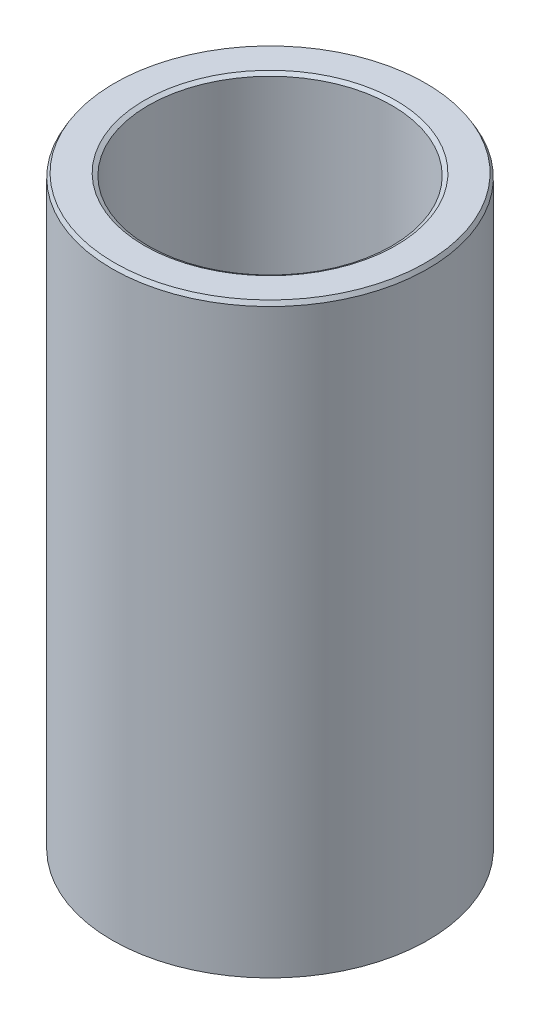
from build123d import *
from OCP.BRepFilletAPI import BRepFilletAPI_MakeChamfer

# Parameters (mm, degrees)
SKETCH1_R           = 57.5
BOSS_EXTRUDE1_DEPTH = 214.036817135
SKETCH2_R           = 44.333103973
CUT_EXTRUDE1_DEPTH  = 229.963444876
CHAMFER1_SIZE       = 1.472510434
CHAMFER1_SIZE2      = 0.850154295


with BuildPart() as part:
    # Sketch1 → Boss-Extrude1 (new body)
    with BuildSketch(Plane(origin=(0, 0, 0), x_dir=(1, 0, 0), z_dir=(0, 1, 0))):
        Circle(SKETCH1_R)
    extrude(amount=BOSS_EXTRUDE1_DEPTH)

    # Sketch2 → Cut-Extrude1 (cut, through all)
    with BuildSketch(Plane(origin=(0, 0, 0), x_dir=(1, 0, 0), z_dir=(0, 1, 0))):
        Circle(SKETCH2_R)
    extrude(amount=CUT_EXTRUDE1_DEPTH, mode=Mode.SUBTRACT)

    # Chamfer1: one chamfer whose edges measure the first distance from different faces: ONE call of the kernel's chamfer builder (chamfer() names one face for all edges)
    chamfer1_edges_1 = [part.edges().sort_by_distance(p)[0] for p in [
        (-44.333103973, 214.036817135, 0),
    ]]
    chamfer1_side_1 = [part.faces().sort_by_distance(p)[0] for p in [
        (-55.873654403, 214.036817135, 0),
    ]]
    chamfer1_edges_2 = [part.edges().sort_by_distance(p)[0] for p in [
        (-44.333103973, 0, 0),
    ]]
    chamfer1_side_2 = [part.faces().sort_by_distance(p)[0] for p in [
        (-44.333103973, 107.018408568, 0),
    ]]
    chamfer1_edges_3 = [part.edges().sort_by_distance(p)[0] for p in [
        (-57.5, 0, 0),
    ]]
    chamfer1_side_3 = [part.faces().sort_by_distance(p)[0] for p in [
        (-55.873654403, 0, 0),
    ]]
    chamfer1_edges_4 = [part.edges().sort_by_distance(p)[0] for p in [
        (-57.5, 214.036817135, 0),
    ]]
    chamfer1_side_4 = [part.faces().sort_by_distance(p)[0] for p in [
        (-57.5, 107.018408568, 0),
    ]]
    chamfer1 = BRepFilletAPI_MakeChamfer(part.part.solid().wrapped)
    for e in chamfer1_edges_1:
        chamfer1.Add(CHAMFER1_SIZE, CHAMFER1_SIZE2, e.wrapped, chamfer1_side_1[0].wrapped)  # the first distance lies on this face
    for e in chamfer1_edges_2:
        chamfer1.Add(CHAMFER1_SIZE, CHAMFER1_SIZE2, e.wrapped, chamfer1_side_2[0].wrapped)  # the first distance lies on this face
    for e in chamfer1_edges_3:
        chamfer1.Add(CHAMFER1_SIZE, CHAMFER1_SIZE2, e.wrapped, chamfer1_side_3[0].wrapped)  # the first distance lies on this face
    for e in chamfer1_edges_4:
        chamfer1.Add(CHAMFER1_SIZE, CHAMFER1_SIZE2, e.wrapped, chamfer1_side_4[0].wrapped)  # the first distance lies on this face
    add(Compound.cast(chamfer1.Shape()), mode=Mode.REPLACE)


solid = part.part
